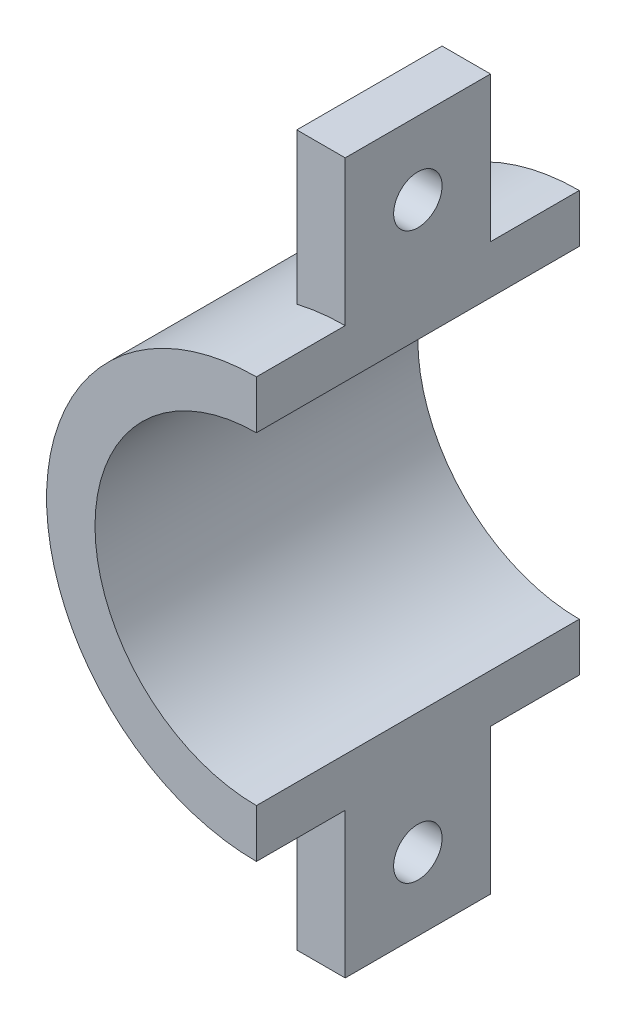
from build123d import *

# Parameters (mm, degrees)
EXTRUDE_1_DEPTH = 20
SKETCH_3_R      = 1.5
EXTRUDE_2_DEPTH = 3


with BuildPart() as part:
    # Эскиз1 → Бобышка-Вытянуть1 (new body)
    with BuildSketch(Plane.XY):
        with BuildLine():
            Line((0, 10), (0, 13))
            ThreePointArc((0, 13), (-13, 0), (0, -13))
            Line((0, -13), (0, -10))
            ThreePointArc((0, -10), (-10, 0), (0, 10))
        make_face()
    extrude(amount=EXTRUDE_1_DEPTH)

    # Эскиз3 → Бобышка-Вытянуть2 (add)
    # profile 1 of 2: a face of its own
    with BuildSketch(Plane(origin=(0, 0, 0), x_dir=(0, 0, -1), z_dir=(1, 0, 0))):
        Polygon((-10, 10), (-14.5, 10), (-14.5, 22), (-5.5, 22), (-5.5, 10), align=None)
        with Locations((-10, 17.5)):
            Circle(SKETCH_3_R, mode=Mode.SUBTRACT)
    # profile 2 of 2: a face of its own
    with BuildSketch(Plane(origin=(0, 0, 0), x_dir=(0, 0, -1), z_dir=(1, 0, 0))):
        Polygon((-10, -10), (-14.5, -10), (-14.5, -22), (-5.5, -22), (-5.5, -10), align=None)
        with Locations((-10, -17.5)):
            Circle(SKETCH_3_R, mode=Mode.SUBTRACT)
    extrude(amount=-EXTRUDE_2_DEPTH)


solid = part.part
